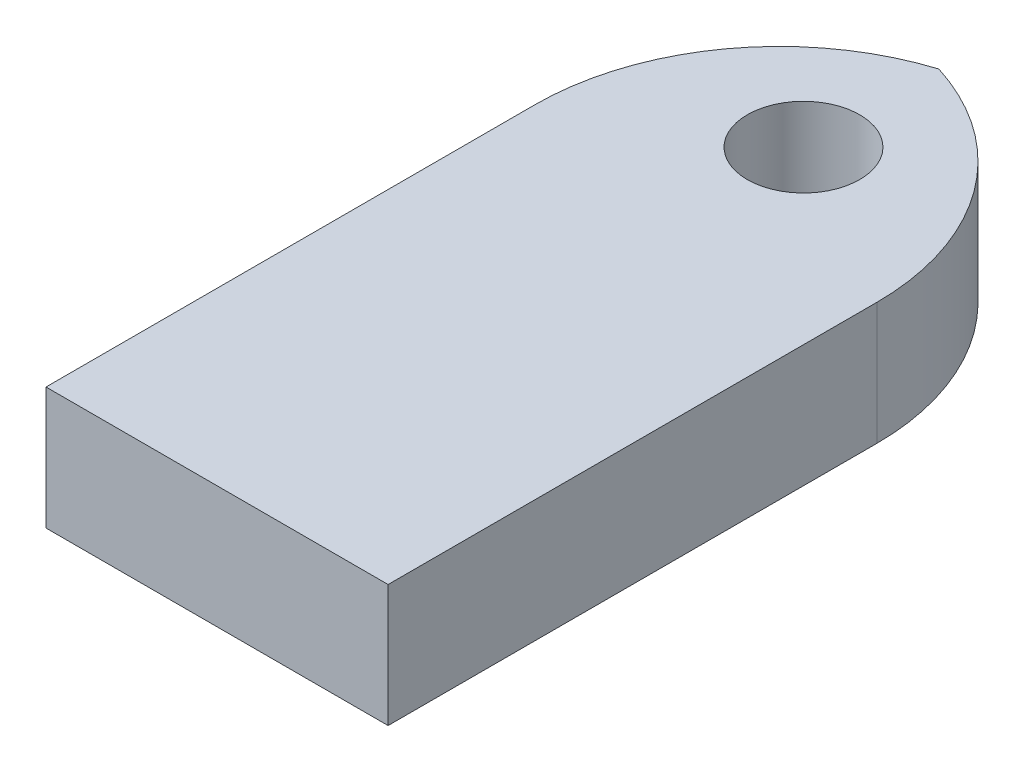
from build123d import *

# Parameters (mm, degrees)
SKETCH1_W           = 8.89
SKETCH1_H           = 19.05
SKETCH1_R           = 1.4605
BOSS_EXTRUDE1_DEPTH = 3.175
FILLET1_R           = 6.35


with BuildPart() as part:
    # Sketch1 → Boss-Extrude1 (new body)
    with BuildSketch(Plane(origin=(0, 0, 0), x_dir=(1, 0, 0), z_dir=(0, 1, 0))):
        with Locations((4.445, 9.525)):
            Rectangle(SKETCH1_W, SKETCH1_H)
        with Locations(Location((4.445, 15.24, 0), (0, 0, 270))):
            Circle(SKETCH1_R, mode=Mode.SUBTRACT)
    extrude(amount=BOSS_EXTRUDE1_DEPTH)

    # Fillet1
    # the kernel refuses this fillet: 6.35 mm, written as the material it takes off along each edge
    with BuildSketch(Plane(origin=(8.89, -15.875, -19.05), x_dir=(0, 0, 1), z_dir=(0, 1, 0)), Plane(origin=(0, -15.875, -19.05), x_dir=(1, 0, 0), z_dir=(0, 1, 0))) as fillet1_piece_1:
        with BuildLine():
            CenterArc((FILLET1_R, -FILLET1_R), FILLET1_R, 90, 90)
            Line((0, -FILLET1_R), (0, 0))
            Line((0, 0), (FILLET1_R, 0))
        make_face()
    extrude(amount=34.925, mode=Mode.SUBTRACT)


solid = part.part
